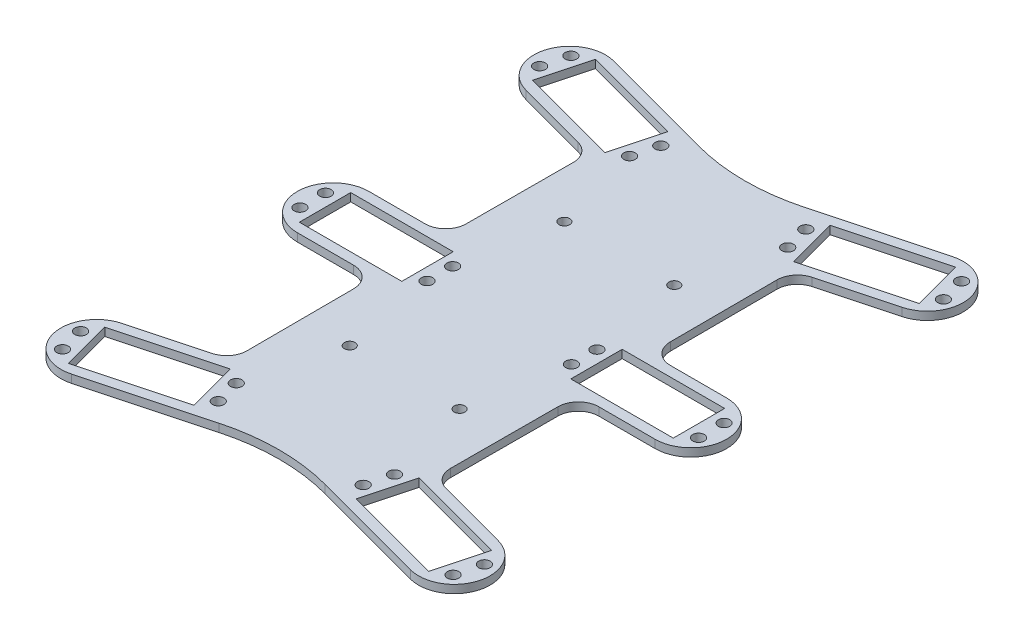
from build123d import *

# Parameters (mm, degrees)
SKETCH1_R           = 2.25
SKETCH1_W           = 40.1
SKETCH1_H           = 20.1
BOSS_EXTRUDE1_DEPTH = 3.175
FILLET1_R           = 80
FILLET2_R           = 8
SKETCH4_R           = 2.1
CUT_EXTRUDE1_DEPTH  = 136.741386774


with BuildPart() as part:
    # Sketch1 → Boss-Extrude1 (new body)
    with BuildSketch(Plane(origin=(0, 0, 0), x_dir=(1, 0, 0), z_dir=(0, 1, 0))):
        with BuildLine():
            Line((-70, 14), (-40, 14))
            Line((-40, 14), (-39.816062711, 70))
            Line((-39.816062711, 70), (-73.623466631, 79.058666579))
            ThreePointArc((-73.623466631, 79.058666579), (-83.522961568, 96.205094778), (-66.376533369, 106.104589715))
            Line((-66.376533369, 106.104589715), (0, 88.319051202))
            Line((0, 88.319051202), (66.376533369, 106.104589715))
            ThreePointArc((66.376533369, 106.104589715), (83.522961568, 96.205094778), (73.623466631, 79.058666579))
            Line((73.623466631, 79.058666579), (39.816062711, 70))
            Line((39.816062711, 70), (40, 14))
            Line((40, 14), (70, 14))
            ThreePointArc((70, 14), (84, 0), (70, -14))
            Line((70, -14), (40, -14))
            Line((40, -14), (39.816062711, -70))
            Line((39.816062711, -70), (73.623466631, -79.058666579))
            ThreePointArc((73.623466631, -79.058666579), (83.522961568, -96.205094778), (66.376533369, -106.104589715))
            Line((66.376533369, -106.104589715), (0, -88.319051202))
            Line((0, -88.319051202), (-66.376533369, -106.104589715))
            ThreePointArc((-66.376533369, -106.104589715), (-83.522961568, -96.205094778), (-73.623466631, -79.058666579))
            Line((-73.623466631, -79.058666579), (-39.816062711, -70))
            Line((-39.816062711, -70), (-40, -14))
            Line((-40, -14), (-70, -14))
            ThreePointArc((-70, -14), (-84, 0), (-70, 14))
        make_face()
        with Locations((-76.433311385, 99.481809639)):
            Circle(SKETCH1_R, mode=Mode.SUBTRACT)
        with Locations((-79.021501836, 89.822551376)):
            Circle(SKETCH1_R, mode=Mode.SUBTRACT)
        with Locations((-78, 5)):
            Circle(SKETCH1_R, mode=Mode.SUBTRACT)
        with Locations((-79.021501836, -89.822551376)):
            Circle(SKETCH1_R, mode=Mode.SUBTRACT)
        with Locations((-76.433311385, -99.481809639)):
            Circle(SKETCH1_R, mode=Mode.SUBTRACT)
        with Locations((-78, -5)):
            Circle(SKETCH1_R, mode=Mode.SUBTRACT)
        with Locations((78, -5)):
            Circle(SKETCH1_R, mode=Mode.SUBTRACT)
        with Locations((76.433311385, -99.481809639)):
            Circle(SKETCH1_R, mode=Mode.SUBTRACT)
        with Locations((79.021501836, -89.822551376)):
            Circle(SKETCH1_R, mode=Mode.SUBTRACT)
        with Locations((78, 5)):
            Circle(SKETCH1_R, mode=Mode.SUBTRACT)
        with Locations((79.021501836, 89.822551376)):
            Circle(SKETCH1_R, mode=Mode.SUBTRACT)
        with Locations((76.433311385, 99.481809639)):
            Circle(SKETCH1_R, mode=Mode.SUBTRACT)
        with Locations((-30.95703272, 76.943715692)):
            Circle(SKETCH1_R, mode=Mode.SUBTRACT)
        with Locations((-28.368842269, 86.602973955)):
            Circle(SKETCH1_R, mode=Mode.SUBTRACT)
        with Locations((-28.24, -5)):
            Circle(SKETCH1_R, mode=Mode.SUBTRACT)
        with Locations((-28.24, 5)):
            Circle(SKETCH1_R, mode=Mode.SUBTRACT)
        with Locations((-28.368842269, -86.602973955)):
            Circle(SKETCH1_R, mode=Mode.SUBTRACT)
        with Locations((-30.95703272, -76.943715692)):
            Circle(SKETCH1_R, mode=Mode.SUBTRACT)
        with Locations((28.368842269, 86.602973955)):
            Circle(SKETCH1_R, mode=Mode.SUBTRACT)
        with Locations((30.95703272, 76.943715692)):
            Circle(SKETCH1_R, mode=Mode.SUBTRACT)
        with Locations((28.24, 5)):
            Circle(SKETCH1_R, mode=Mode.SUBTRACT)
        with Locations((28.24, -5)):
            Circle(SKETCH1_R, mode=Mode.SUBTRACT)
        with Locations((30.95703272, -76.943715692)):
            Circle(SKETCH1_R, mode=Mode.SUBTRACT)
        with Locations((28.368842269, -86.602973955)):
            Circle(SKETCH1_R, mode=Mode.SUBTRACT)
        Polygon((-70.460853466, 103.109639074), (-75.663116273, 83.694529965), (-36.929490638, 73.315886257), (-31.727227832, 92.730995365), align=None, mode=Mode.SUBTRACT)
        with Locations((-53.12, 0)):
            Rectangle(SKETCH1_W, SKETCH1_H, mode=Mode.SUBTRACT)
        Polygon((-36.929490638, -73.315886257), (-31.727227832, -92.730995365), (-70.460853466, -103.109639074), (-75.663116273, -83.694529965), align=None, mode=Mode.SUBTRACT)
        Polygon((36.929490638, 73.315886257), (31.727227832, 92.730995365), (70.460853466, 103.109639074), (75.663116273, 83.694529965), align=None, mode=Mode.SUBTRACT)
        with Locations((53.12, 0)):
            Rectangle(SKETCH1_W, SKETCH1_H, mode=Mode.SUBTRACT)
        Polygon((36.929490638, -73.315886257), (31.727227832, -92.730995365), (70.460853466, -103.109639074), (75.663116273, -83.694529965), align=None, mode=Mode.SUBTRACT)
    extrude(amount=BOSS_EXTRUDE1_DEPTH)

    # Fillet1
    fillet1_edges = [part.edges().sort_by_distance(p)[0] for p in [
        (0, 1.5875, -88.319051202),
        (0, 1.5875, 88.319051202),
    ]]
    fillet(fillet1_edges, radius=FILLET1_R)

    # Fillet2
    fillet2_edges = [part.edges().sort_by_distance(p)[0] for p in [
        (39.816062711, 1.5875, 70),
        (40, 1.5875, 14),
        (40, 1.5875, -14),
        (39.816062711, 1.5875, -70),
        (-39.816062711, 1.5875, -70),
        (-40, 1.5875, -14),
        (-40, 1.5875, 14),
        (-39.816062711, 1.5875, 70),
    ]]
    fillet(fillet2_edges, radius=FILLET2_R)

    # Sketch4 → Cut-Extrude1 (cut, through all)
    with BuildSketch(Plane(origin=(0, 3.175, 0), x_dir=(1, 0, 0), z_dir=(0, 1, 0))):
        with Locations((-21.5, 42)):
            Circle(SKETCH4_R)
        with Locations((21.5, 42)):
            Circle(SKETCH4_R)
        with Locations((21.5, -42)):
            Circle(SKETCH4_R)
        with Locations((-21.5, -42)):
            Circle(SKETCH4_R)
    extrude(amount=-CUT_EXTRUDE1_DEPTH, mode=Mode.SUBTRACT)


solid = part.part
